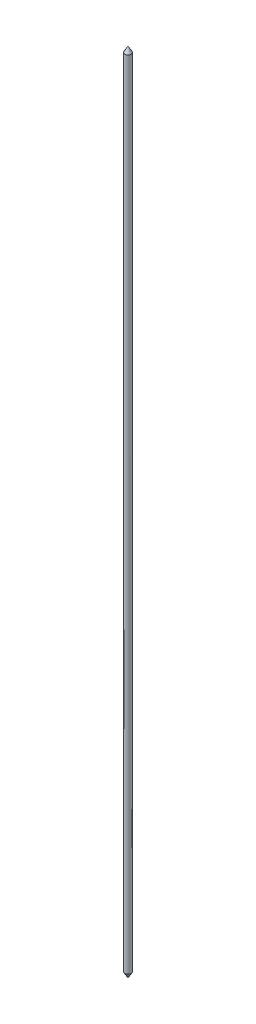
from build123d import *

# Parameters (mm, degrees)
CROQUIS1_R              = 1
SALIENTE_EXTRUIR1_DEPTH = 250


with BuildPart() as part:
    # Croquis1 → Saliente-Extruir1 (new body)
    with BuildSketch(Plane(origin=(0, 0, 0), x_dir=(1, 0, 0), z_dir=(0, 1, 0))):
        Circle(CROQUIS1_R)
    extrude(amount=SALIENTE_EXTRUIR1_DEPTH)

    # Saliente-Extruir2 cone 1 section (through the dimple's axis) → Saliente-Extruir2 (revolve)
    with BuildSketch(Plane(origin=(0, 250, 0), x_dir=(0, 0, -1), z_dir=(1, 0, 0))):
        Polygon((0, 0), (1, 0), (0, 1.732050808), align=None)
    revolve(axis=Axis((0, 250, 0), (0, 1, 0)))

    # Saliente-Extruir3 cone 1 section (through the dimple's axis) → Saliente-Extruir3 (revolve)
    with BuildSketch(Plane(origin=(0, 0, 0), x_dir=(0, 0, 1), z_dir=(1, 0, 0))):
        Polygon((0, 0), (1, 0), (0, 1.732050808), align=None)
    revolve(axis=Axis((0, 0, 0), (0, -1, 0)))


solid = part.part
